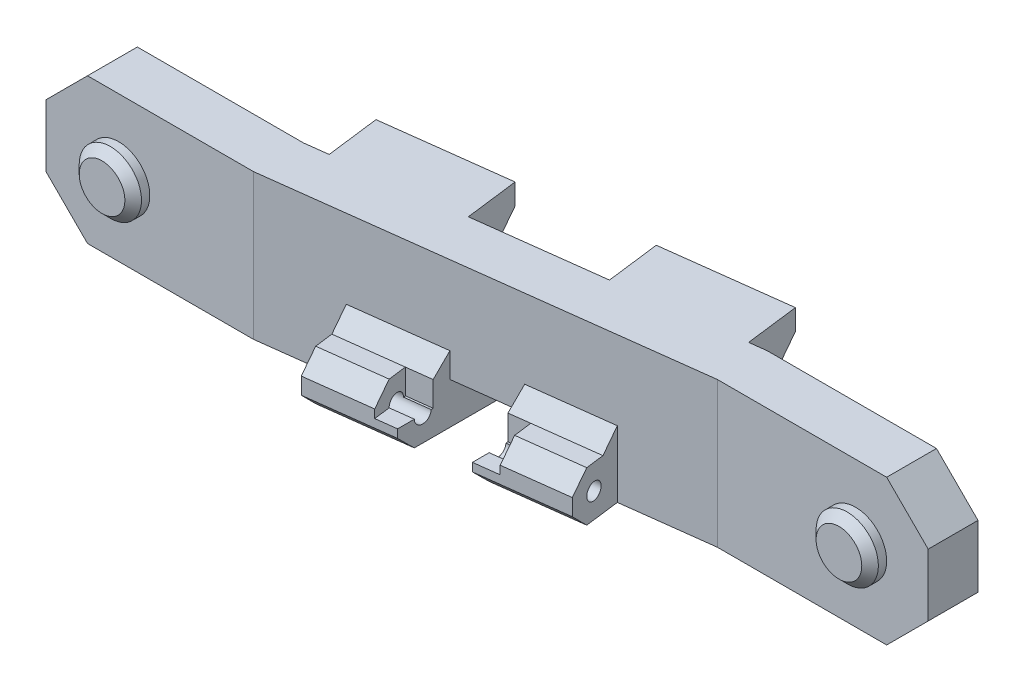
from build123d import *

# Parameters (mm, degrees)
BOSS_EXTRUDE4_DEPTH      = 2.4
BOSS_EXTRUDE4_2_DEPTH    = 2.4
BOSS_EXTRUDE4_3_DEPTH    = 2.4
BOSS_EXTRUDE4_4_DEPTH    = 2.4
BOSS_EXTRUDE5_DEPTH      = 7
SKETCH2_R                = 1.499999999999997
BOSS_EXTRUDE8_DEPTH      = 0.8
SKETCH3_R                = 1.5000000000000007
BOSS_EXTRUDE9_DEPTH      = 0.8
SKETCH4_R                = 1.6999999999999995
CUT_EXTRUDE3_DEPTH       = 1.2
SKETCH5_R                = 1.6999999999999995
CUT_EXTRUDE4_DEPTH       = 1.2
CHAMFER4_SIZE            = 2
CUT_EXTRUDE7_REACH       = 33.32
SKETCH8_R                = 0.3999999999999905
SKETCH8_R_2              = 0.4000000000000032
CUT_EXTRUDE10_DEPTH      = 2
CHAMFER6_SIZE            = 0.8
CUT_EXTRUDE11_DEPTH      = 10
CUT_EXTRUDE11_DEPTH_BACK = 1.2
BOSS_EXTRUDE10_DEPTH     = 3.6
CHAMFER8_SIZE            = 2.6
CHAMFER9_SIZE            = 0.4


with BuildPart() as part:
    # Sketch1 → Boss-Extrude4 (new body)
    with BuildSketch(Plane(origin=(0, 0, 0), x_dir=(1, 0, 0), z_dir=(0, 1, 0))):
        Polygon((-6.033824051637797, -1.9503087992717978), (-5.721324051637796, -4.430700653394863), (-1.5999999999999996, -3.911462628969018), (-1.5999999999999994, -1.3916994755741596), align=None)
    extrude(amount=BOSS_EXTRUDE4_DEPTH)



with BuildPart() as body_2:
    # Sketch1 → Boss-Extrude4 2 (new body)
    with BuildSketch(Plane(origin=(0, 0, 0), x_dir=(1, 0, 0), z_dir=(0, 1, 0))):
        Polygon((-10.000000000000064, 2.4499999999999993), (-9.689951018234682, -0.01093750000000027), (-5.919755399967642, 0.4640624999999997), (-6.229804381733024, 2.9250000000000003), align=None)
    extrude(amount=BOSS_EXTRUDE4_2_DEPTH)


with BuildPart() as body_3:
    # Sketch1 → Boss-Extrude4 3 (new body)
    with BuildSketch(Plane(origin=(0, 0, 0), x_dir=(1, 0, 0), z_dir=(0, 1, 0))):
        Polygon((5.564458884622125, -0.4890625000000022), (1.6000000000000032, -0.9885373710309839), (1.6000000000000008, -3.508300524425846), (5.876958884622125, -2.969454354123069), align=None)
    extrude(amount=BOSS_EXTRUDE4_3_DEPTH)


with BuildPart() as body_4:
    # Sketch1 → Boss-Extrude4 4 (new body)
    with BuildSketch(Plane(origin=(0, 0, 0), x_dir=(1, 0, 0), z_dir=(0, 1, 0))):
        Polygon((5.7628902329519684, 4.435937500000006), (6.072939214717352, 1.9750000000000023), (9.843134832984354, 2.4499999999999993), (9.533085851218969, 4.910937500000012), align=None)
    extrude(amount=BOSS_EXTRUDE4_4_DEPTH)


with BuildPart() as part_1:
    add(part.part)

    add(body_2.part)  # Boss-Extrude5 merges body 2

    add(body_3.part)  # Boss-Extrude5 merges body 3

    add(body_4.part)  # Boss-Extrude5 merges body 4
    # Sketch1<8> → Boss-Extrude5 (add)
    with BuildSketch(Plane(origin=(0, 0, 0), x_dir=(1, 0, 0), z_dir=(0, 1, 0))):
        Polygon((-20, -0.05000000000000027), (-20, -2.45), (-12, -2.4499999999999997), (-10.000000000000064, -2.4499999999999997), (-6.033824051637797, -1.950308799271796), (-1.9124999999999996, -1.431070774845953), (-1.6000000000000032, -1.391699475574159), (-1.5999999999999999, 1.0083005244258434), (-5.919755399967642, 0.4640624999999997), (-9.689951018234682, -0.01093750000000025), (-10.000000000000064, -0.05000000000000029), (-12, -0.05000000000000027), align=None)
        Polygon((1.6000000000000003, 1.4114626289690202), (1.6000000000000005, -0.988537371030981), (5.564458884622125, -0.4890625000000022), (9.687500000000064, 0.03039185412306233), (9.843134832984425, 0.05000000000000027), (12, 0.05000000000000013), (20, 0.05000000000000013), (20, 2.4499999999999997), (12, 2.4499999999999993), (9.843134832984353, 2.4499999999999993), (6.072939214717351, 1.975000000000004), (1.9100489817653816, 1.4505251289690204), align=None)
        Polygon((-1.5999999999999999, 1.0083005244258434), (-1.5999999999999994, -1.3916994755741596), (1.6000000000000032, -0.9885373710309839), (1.6000000000000003, 1.4114626289690202), align=None)
    extrude(amount=BOSS_EXTRUDE5_DEPTH)

    # Sketch2 → Boss-Extrude8 (add)
    with BuildSketch(Plane.XY.offset(2.4499999999999993)):
        with Locations(Location((-16.5, 3.4999999999999996, 0), (0, 0, 180))):
            Circle(SKETCH2_R)
    extrude(amount=BOSS_EXTRUDE8_DEPTH)

    # Sketch3 → Boss-Extrude9 (add)
    with BuildSketch(Plane.XY.offset(-0.05000000000000013)):
        with Locations(Location((16.5, 3.4999999999999996, 0), (0, 0, 180))):
            Circle(SKETCH3_R)
    extrude(amount=BOSS_EXTRUDE9_DEPTH)

    # Sketch4 → Cut-Extrude3 (cut)
    with BuildSketch(Plane(origin=(0, 0, 0.05000000000000041), x_dir=(-1, 0, -5e-17), z_dir=(5e-17, 0, -1))):
        with Locations((16.5, 3.4999999999999996)):
            Circle(SKETCH4_R)
    extrude(amount=-CUT_EXTRUDE3_DEPTH, mode=Mode.SUBTRACT)

    # Sketch5 → Cut-Extrude4 (cut)
    with BuildSketch(Plane(origin=(-1e-16, 0, -2.449999999999999), x_dir=(-1, 0, 5e-17), z_dir=(-5e-17, 0, -1))):
        with Locations((-16.5, 3.4999999999999996)):
            Circle(SKETCH5_R)
    extrude(amount=-CUT_EXTRUDE4_DEPTH, mode=Mode.SUBTRACT)

    # Chamfer4
    chamfer4_edges = [part_1.edges().sort_by_distance(p)[0] for p in [
        (20, 7, -1.25),
        (-20, 7, 1.2500000000000002),
        (-20, 0, 1.2500000000000002),
        (20, 0, -1.25),
    ]]
    chamfer(chamfer4_edges, length=CHAMFER4_SIZE)

    # Cut-Extrude7: up to this face of the body (flat: up to its plane)
    cut_extrude7_end = Plane(part_1.part.faces().sort_by_distance((-9.844975509, 1.2, -1.21953125))[0])
    # Sketch8 → Cut-Extrude7 (cut, up to the picked face)
    with BuildSketch(Plane(origin=(9.99318385334905, 0, -1.2590228229384695), x_dir=(-0.12500000000000053, 0, -0.9921567416492215), z_dir=(0.9921567416492215, 0, -0.12500000000000053)), mode=Mode.PRIVATE) as cut_extrude7_sk1:
        with Locations((2.4807840170405906, 1.2000000000000017)):
            Circle(SKETCH8_R)
    cut_extrude7_tool1 = split(extrude(cut_extrude7_sk1.sketch, amount=-CUT_EXTRUDE7_REACH, mode=Mode.PRIVATE), bisect_by=cut_extrude7_end, keep=Keep.BOTH, mode=Mode.PRIVATE)
    # Sketch8 → Cut-Extrude7 (cut, up to the picked face)
    with BuildSketch(Plane(origin=(9.99318385334905, 0, -1.2590228229384695), x_dir=(-0.12500000000000053, 0, -0.9921567416492215), z_dir=(0.9921567416492215, 0, -0.12500000000000053)), mode=Mode.PRIVATE) as cut_extrude7_sk2:
        with Locations((-2.4807840170405973, 1.200000000000001)):
            Circle(SKETCH8_R_2)
    cut_extrude7_tool2 = split(extrude(cut_extrude7_sk2.sketch, amount=-CUT_EXTRUDE7_REACH, mode=Mode.PRIVATE), bisect_by=cut_extrude7_end, keep=Keep.BOTH, mode=Mode.PRIVATE)
    add(cut_extrude7_tool1.solids().sort_by(Axis((9.683086, 1.2, -3.720349), (-0.9921567416492215, 0, 0.12500000000000053)))[0], mode=Mode.SUBTRACT)
    add(cut_extrude7_tool2.solids().sort_by(Axis((10.303282, 1.2, 1.202304), (-0.9921567416492215, 0, 0.12500000000000053)))[0], mode=Mode.SUBTRACT)

    # Sketch1<10> → Cut-Extrude10 (cut)
    with BuildSketch(Plane(origin=(0, 0, 0), x_dir=(1, 0, 0), z_dir=(0, 1, 0))):
        Polygon((-1.5999999999999999, 1.0083005244258434), (-1.5999999999999994, -1.3916994755741596), (1.6000000000000032, -0.9885373710309839), (1.6000000000000003, 1.4114626289690202), align=None)
        Polygon((-1.6, 3.5083005244258283), (-1.5999999999999999, 1.0083005244258434), (1.5999999999999979, 1.4114626289690202), (1.6, 3.9114626289690166), align=None)
        Polygon((1.6000000000000032, -0.9885373710309839), (-1.6000000000000032, -1.391699475574159), (-1.5999999999999992, -3.91146262896902), (1.6000000000000014, -3.5083005244258425), align=None)
    extrude(amount=CUT_EXTRUDE10_DEPTH, mode=Mode.SUBTRACT)

    # Chamfer6
    chamfer6_edges = [part_1.edges().sort_by_distance(p)[0] for p in [
        (-3.816912025818899, 2.4, 1.6710041374229787),
        (-3.660662025818898, 2.4, 4.17108164118194),
        (3.738479442311063, 0, 3.2388774392744577),
        (3.582229442311064, 2.4, 0.7387999355154931),
        (3.738479442311063, 2.4, 3.2388774392744577),
        (7.647988042085475, 2.4, -4.673437499999995),
        (7.958037023850853, 2.4, -2.2125000000000017),
        (7.647988042085475, 0, -4.673437499999995),
        (-3.660662025818898, 0, 4.17108164118194),
        (-8.114902190866543, 2.4, -2.6874999999999987),
        (-7.804853209101163, 2.4, -0.22656249999999975),
        (-8.114902190866543, 0, -2.6874999999999987),
    ]]
    chamfer(chamfer6_edges, length=CHAMFER6_SIZE)

    # Sketch9 → Cut-Extrude11 (cut, two sides: drawn at the far end of the back side and taken through both)
    with BuildSketch(Plane(origin=(0, 2.4, 0), x_dir=(1, 0, 0), z_dir=(0, 1, 0)).offset(-CUT_EXTRUDE11_DEPTH_BACK)):
        Polygon((-10.000000000000064, 2.4499999999999984), (-9.789951018234682, 0.7827878933193786), (-8.599362928255616, 0.9327878933193787), (-8.809411910021, 2.5999999999999988), align=None)
        Polygon((-1.5999999999999994, -2.198023684660508), (-2.7905880899790625, -2.348023684660507), (-2.578088089979061, -4.0346901454641975), (-1.3874999999999975, -3.884690145464198), align=None)
        Polygon((1.6000000000000008, -3.508300524425844), (1.3874999999999984, -1.8216340636221509), (2.5780880899790635, -1.671634063622151), (2.790588089979066, -3.3583005244258444), align=None)
        Polygon((9.533085851218972, 4.910937499999992), (8.342497761239906, 4.760937499999993), (8.552546743005287, 3.0937253933193816), (9.743134832984353, 3.2437253933193815), align=None)
    extrude(amount=CUT_EXTRUDE11_DEPTH + CUT_EXTRUDE11_DEPTH_BACK, mode=Mode.SUBTRACT)

    # Sketch10 → Boss-Extrude10 (add)
    with BuildSketch(Plane(origin=(0, 6.999999999999999, 0), x_dir=(1, 0, 0), z_dir=(0, 1, 0))):
        Polygon((8.724409439665015, 4.929607528287985), (2.7714689897696854, 4.179607528287982), (3.0964689897696878, 1.600000000000004), (9.04940943966502, 2.3500000000000094), align=None)
        Polygon((-9.221225624915308, 2.6686700282879747), (-8.896225624915308, 0.08906249999999957), (-2.943285175019977, 0.8390625000000002), (-3.2682851750199777, 3.418670028287977), align=None)
    extrude(amount=-BOSS_EXTRUDE10_DEPTH)

    # Chamfer8
    chamfer8_edges = [part_1.edges().sort_by_distance(p)[0] for p in [
        (-6.244755399967643, 3.399999999999999, -3.0436700282879756),
        (5.74793921471735, 3.399999999999999, -4.554607528287983),
    ]]
    chamfer(chamfer8_edges, length=CHAMFER8_SIZE - 0.0001)  # a hair under: the kernel refuses the full size

    # Chamfer9
    chamfer9_edges = [part_1.edges().sort_by_distance(p)[0] for p in [
        (-15.000000000000004, 3.499999999999999, 3.249999999999999),
        (18, 3.499999999999999, 0.7499999999999999),
    ]]
    chamfer(chamfer9_edges, length=CHAMFER9_SIZE)


solid = part_1.part
